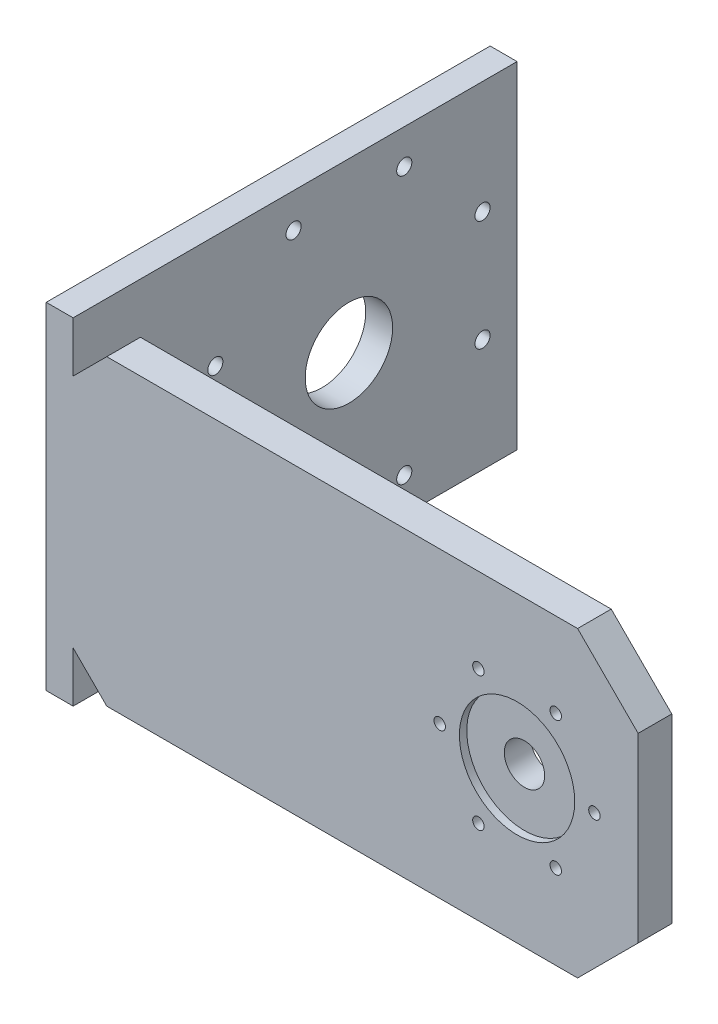
from build123d import *

# Parameters (mm, degrees)
SK_TOP_PLATE_R         = 1.7
SK_TOP_PLATE_R_2       = 6
TOP_PLATE_DEPTH        = 10
SK_YAW_PILOT_RECESS_R  = 17.15
YAW_PILOT_RECESS_DEPTH = 2.2
SK_BACK_PLATE_W        = 132
SK_BACK_PLATE_H        = 100
SK_BACK_PLATE_R        = 2.25
SK_BACK_PLATE_R_2      = 13
BACK_PLATE_DEPTH       = 8
RIB_DEPTH              = 8


with BuildPart() as part:
    # SK_Top_Plate → Top_Plate (new body)
    with BuildSketch(Plane.XY.offset(72)):
        Polygon((-122, -45), (18, -45), (36, -27), (36, 27), (18, 45), (-122, 45), (-140, 27), (-140, -27), align=None)
        with Locations((23, 0)):
            Circle(SK_TOP_PLATE_R, mode=Mode.SUBTRACT)
        with Locations((11.5, 19.918584287)):
            Circle(SK_TOP_PLATE_R, mode=Mode.SUBTRACT)
        with Locations((-11.5, 19.918584287)):
            Circle(SK_TOP_PLATE_R, mode=Mode.SUBTRACT)
        with Locations((-23, 0)):
            Circle(SK_TOP_PLATE_R, mode=Mode.SUBTRACT)
        with Locations((-11.5, -19.918584287)):
            Circle(SK_TOP_PLATE_R, mode=Mode.SUBTRACT)
        with Locations((11.5, -19.918584287)):
            Circle(SK_TOP_PLATE_R, mode=Mode.SUBTRACT)
        Circle(SK_TOP_PLATE_R_2, mode=Mode.SUBTRACT)
    extrude(amount=TOP_PLATE_DEPTH)

    # SK_Yaw_Pilot_Recess → Yaw_Pilot_Recess (cut)
    with BuildSketch(Plane.XY.offset(82)):
        Circle(SK_YAW_PILOT_RECESS_R)
    extrude(amount=-YAW_PILOT_RECESS_DEPTH, mode=Mode.SUBTRACT)

    # SK_Back_Plate → Back_Plate (add)
    with BuildSketch(Plane(origin=(-140, 0, 0), x_dir=(0, 0, -1), z_dir=(1, 0, 0))):
        with Locations((-16, 0)):
            Rectangle(SK_BACK_PLATE_W, SK_BACK_PLATE_H)
        with Locations((39.726819898, 16.455387592)):
            Circle(SK_BACK_PLATE_R, mode=Mode.SUBTRACT)
        with Locations((16.455387592, 39.726819898)):
            Circle(SK_BACK_PLATE_R, mode=Mode.SUBTRACT)
        with Locations((-16.455387592, 39.726819898)):
            Circle(SK_BACK_PLATE_R, mode=Mode.SUBTRACT)
        with Locations((-39.726819898, 16.455387592)):
            Circle(SK_BACK_PLATE_R, mode=Mode.SUBTRACT)
        with Locations((-39.726819898, -16.455387592)):
            Circle(SK_BACK_PLATE_R, mode=Mode.SUBTRACT)
        with Locations((-16.455387592, -39.726819898)):
            Circle(SK_BACK_PLATE_R, mode=Mode.SUBTRACT)
        with Locations((16.455387592, -39.726819898)):
            Circle(SK_BACK_PLATE_R, mode=Mode.SUBTRACT)
        with Locations((39.726819898, -16.455387592)):
            Circle(SK_BACK_PLATE_R, mode=Mode.SUBTRACT)
        Circle(SK_BACK_PLATE_R_2, mode=Mode.SUBTRACT)
    extrude(amount=BACK_PLATE_DEPTH)

    # SK_Rib → Rib (add)
    with BuildSketch(Plane(origin=(0, -4, 0), x_dir=(1, 0, 0), z_dir=(0, 1, 0))):
        Polygon((-140, -52), (-30, -72), (-140, -72), align=None)
    extrude(amount=RIB_DEPTH)


solid = part.part
